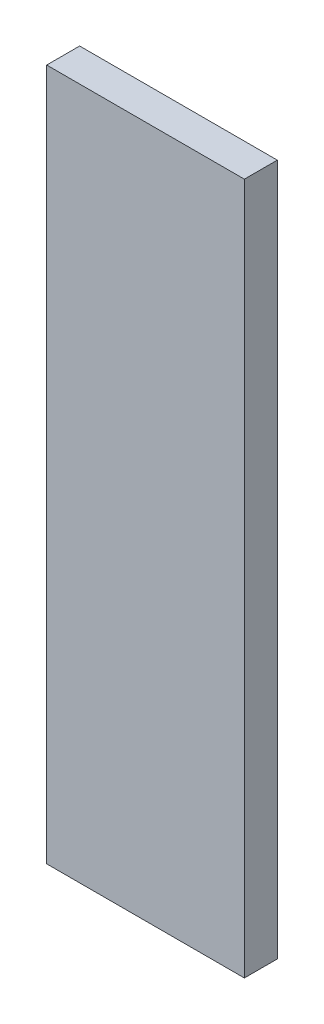
from build123d import *

# Parameters (mm, degrees)
SKETCH_1_W             = 60
SKETCH_1_H             = 210
SM_BASE_FLANGE_1_DEPTH = 10


# Sheet-metal steps are written as plain solids
with BuildPart() as part:
    # Sketch 1 → Базовая кромка1 (new body)
    with BuildSketch(Plane.XY):
        with Locations((30, -105)):
            Rectangle(SKETCH_1_W, SKETCH_1_H)
    extrude(amount=-SM_BASE_FLANGE_1_DEPTH)


solid = part.part
